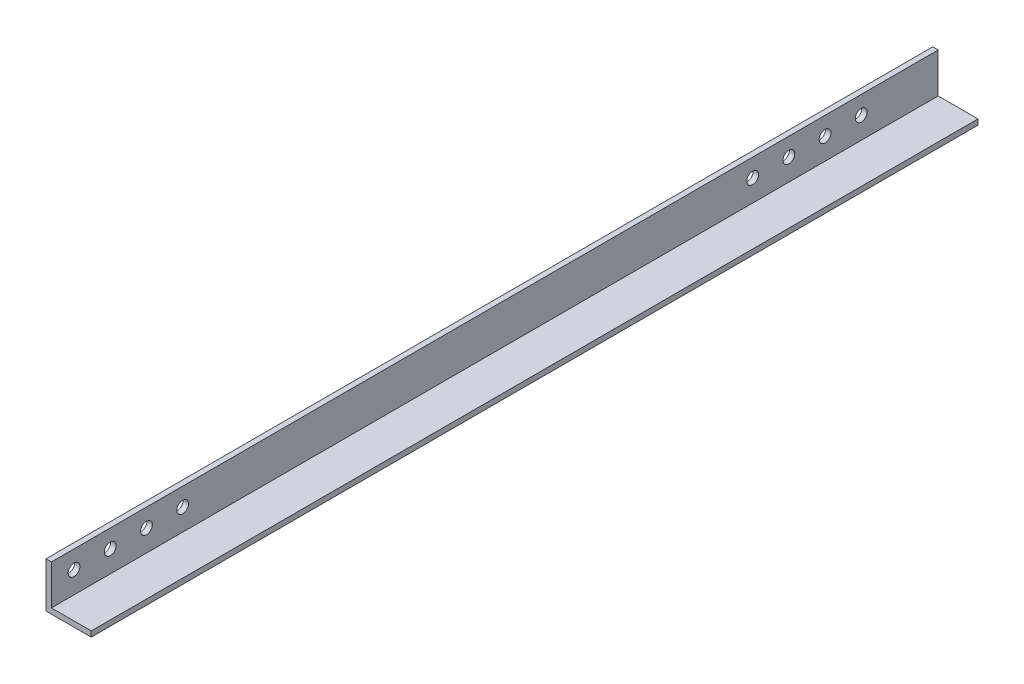
from build123d import *

# Parameters (mm, degrees)
SKETCH_1_W             = 100
SKETCH_1_H             = 100
EXTRUDE_1_DEPTH        = 1960
SKETCH_2_W             = 88
SKETCH_2_H             = 88
CUT_EXTRUDE_1_DEPTH    = 1966.095417531
SKETCH_3_R             = 13
CUT_EXTRUDE_2_DEPTH    = 1965.521315741
PATTERN_LINEAR_1_COUNT = 4
PATTERN_LINEAR_1_PITCH = 80
SKETCH_4_R             = 13
CUT_EXTRUDE_3_DEPTH    = 1965.521315741
PATTERN_LINEAR_2_COUNT = 4
PATTERN_LINEAR_2_PITCH = 80


with BuildPart() as part:
    # 草图1 → 凸台-拉伸1 (new body)
    with BuildSketch(Plane.XY):
        with Locations((50, 50)):
            Rectangle(SKETCH_1_W, SKETCH_1_H)
    extrude(amount=EXTRUDE_1_DEPTH)

    # 草图2 → 切除-拉伸1 (cut, through all)
    with BuildSketch(Plane.XY.offset(1960)):
        with Locations((56, 56)):
            Rectangle(SKETCH_2_W, SKETCH_2_H)
    extrude(amount=-CUT_EXTRUDE_1_DEPTH, mode=Mode.SUBTRACT)

    # 草图3 → 切除-拉伸2 (cut, through all)
    with BuildSketch(Plane(origin=(12, 0, 0), x_dir=(0, 0, -1), z_dir=(1, 0, 0))):
        with Locations((-1910, 60)):
            Circle(SKETCH_3_R)
    cut_extrude_2 = extrude(amount=-CUT_EXTRUDE_2_DEPTH, mode=Mode.SUBTRACT)

    # 阵列(线性)1: 切除-拉伸2 ×4
    with Locations(*[(0, 0, -i * PATTERN_LINEAR_1_PITCH) for i in range(1, PATTERN_LINEAR_1_COUNT)]):
        add(cut_extrude_2, mode=Mode.SUBTRACT)

    # 草图4 → 切除-拉伸3 (cut, through all)
    with BuildSketch(Plane(origin=(12, 0, 0), x_dir=(0, 0, -1), z_dir=(1, 0, 0))):
        with Locations((-170, 60)):
            Circle(SKETCH_4_R)
    cut_extrude_3 = extrude(amount=-CUT_EXTRUDE_3_DEPTH, mode=Mode.SUBTRACT)

    # 阵列(线性)2: 切除-拉伸3 ×4
    with Locations(*[(0, 0, i * PATTERN_LINEAR_2_PITCH) for i in range(1, PATTERN_LINEAR_2_COUNT)]):
        add(cut_extrude_3, mode=Mode.SUBTRACT)


solid = part.part
